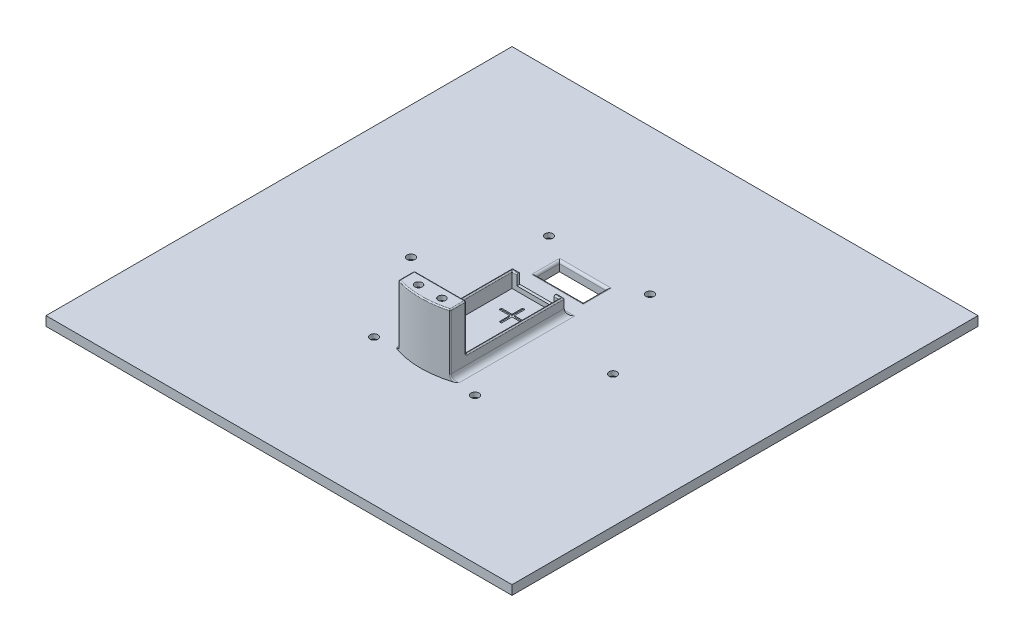
from build123d import *

# Parameters (mm, degrees)
SZKIC1_R                    = 89
DODANIE_WYCI_GNI_CIE2_DEPTH = 4
WYTNIJ_WYCI_GNI_CIE2_DEPTH  = 0.5
SKETCH7_W                   = 20.2
SKETCH7_H                   = 40.9
BOSS_EXTRUDE3_DEPTH         = 6.5
SKETCH8_R                   = 44.4
BOSS_EXTRUDE5_DEPTH         = 1.663834843
SKETCH9_R                   = 39.396065793
CUT_EXTRUDE1_DEPTH          = 9999.5
BOSS_EXTRUDE6_DEPTH         = 20
SKETCH11_R                  = 2.25
CUT_EXTRUDE3_DEPTH          = 5
SKETCH12_R                  = 1.7
CUT_EXTRUDE4_DEPTH          = 10
CUT_EXTRUDE5_DEPTH          = 10
BOSS_EXTRUDE8_DEPTH         = 2
SKETCH21_R                  = 1.6
CUT_EXTRUDE6_DEPTH          = 2
FILLET5_R                   = 2
FILLET6_R                   = 2.5
FILLET7_R                   = 2
SKETCH24_R                  = 1.7
CUT_EXTRUDE7_DEPTH          = 15
CHAMFER1_SIZE               = 2
SKETCH25_W                  = 20.2
SKETCH25_H                  = 10
CUT_EXTRUDE8_DEPTH          = 10
FILLET8_R                   = 1
FILLET10_R                  = 0.5
FILLET16_R                  = 0.5
SKETCH26_W                  = 8
SKETCH26_H                  = 4
SKETCH26_H_2                = 2.729527053
CUT_EXTRUDE9_DEPTH          = 10
BOSS_EXTRUDE9_DEPTH         = 4


with BuildPart() as part:
    # Szkic1 → Dodanie-wyciągnięcie2 (new body)
    with BuildSketch(Plane(origin=(0, 0, 0), x_dir=(1, 0, 0), z_dir=(0, 1, 0))):
        with Locations(Location((0, 0, 0), (0, 0, 270))):
            Circle(SZKIC1_R)
    extrude(amount=DODANIE_WYCI_GNI_CIE2_DEPTH)

    # Szkic4 → Wytnij-wyciągnięcie2 (cut)
    with BuildSketch(Plane(origin=(0, 4, 0), x_dir=(1, 0, 0), z_dir=(0, 1, 0))):
        Polygon((5, 0.5), (5, 0), (5, -0.5), (0.5, -0.5), (0.5, -5), (-0.5, -5), (-0.5, -0.5), (-5, -0.5), (-5, 0.5), (-0.5, 0.5), (-0.5, 5), (0.5, 5), (0.5, 0.5), align=None)
    extrude(amount=-WYTNIJ_WYCI_GNI_CIE2_DEPTH, mode=Mode.SUBTRACT)

    # Sketch7 → Boss-Extrude3 (add)
    with BuildSketch(Plane(origin=(0, 4, 0), x_dir=(1, 0, 0), z_dir=(0, 1, 0))):
        with BuildLine():
            Line((-11.1, 11.319281106), (-11.1, -37.544014806))
            ThreePointArc((-11.1, -37.544014806), (0, -39.150517848), (11.1, -37.544014806))
            Line((11.1, -37.544014806), (11.1, 11.319281106))
            Line((11.1, 11.319281106), (-11.1, 11.319281106))
        make_face()
        with Locations((0, -10.35)):
            Rectangle(SKETCH7_W, SKETCH7_H, mode=Mode.SUBTRACT)
    extrude(amount=BOSS_EXTRUDE3_DEPTH)


with BuildPart() as body_2:
    # Sketch8 → Boss-Extrude5 (new body)
    with BuildSketch(Plane(origin=(0, 4, 0), x_dir=(1, 0, 0), z_dir=(0, 1, 0))):
        with Locations(Location((0, 0, 0), (0, 0, 270))):
            Circle(SKETCH8_R)
    extrude(amount=-BOSS_EXTRUDE5_DEPTH)

    # Sketch9 → Cut-Extrude1 (cut)
    with BuildSketch(Plane(origin=(0, 2.336165157, 0), x_dir=(-1, 0, 0), z_dir=(0, -1, 0))):
        with Locations(Location((0, 0, 0), (0, 0, 90))):
            Circle(SKETCH9_R)
    extrude(amount=-CUT_EXTRUDE1_DEPTH, mode=Mode.SUBTRACT)

    # Combine2: union part
    add(part.part)

    # Sketch10 → Boss-Extrude6 (add)
    with BuildSketch(Plane(origin=(0, 10.5, 0), x_dir=(1, 0, 0), z_dir=(0, 1, 0))):
        with BuildLine():
            Line((10.1, -30.8), (-10.1, -30.8))
            Line((-10.1, -30.8), (-11.1, -30.8))
            Line((-11.1, -30.8), (-11.1, -37.544014806))
            ThreePointArc((-11.1, -37.544014806), (0, -39.150517848), (11.1, -37.544014806))
            Line((11.1, -37.544014806), (11.1, -30.8))
            Line((11.1, -30.8), (10.1, -30.8))
        make_face()
    extrude(amount=BOSS_EXTRUDE6_DEPTH)

    # Sketch11 → Cut-Extrude3 (cut)
    # profile 1 of 8: a face of its own
    with BuildSketch(Plane(origin=(0, 30.5, 0), x_dir=(1, 0, 0), z_dir=(0, 1, 0))):
        with BuildLine():
            Line((-2.855061196, -32.526564386), (-4.921306965, -32.232478095))
            Line((-4.921306965, -32.232478095), (-4.921306965, -32.911704184))
            ThreePointArc((-4.921306965, -32.911704184), (-3.330316708, -33.570713926), (-2.671306965, -35.161704184))
            ThreePointArc((-2.671306965, -35.161704184), (-4.921306965, -37.411704184), (-7.171306965, -35.161704184))
            Line((-7.171306965, -35.161704184), (-8.046848952, -35.161704184))
            Line((-8.046848952, -35.161704184), (-6.987552735, -37.796843981))
            Line((-6.987552735, -37.796843981), (-3.672331843, -38.268695409))
            Line((-3.672331843, -38.268695409), (-1.606086073, -35.633555612))
            Line((-1.606086073, -35.633555612), (-2.855061196, -32.526564386))
        make_face()
    # profile 2 of 8: a face of its own
    with BuildSketch(Plane(origin=(0, 30.5, 0), x_dir=(1, 0, 0), z_dir=(0, 1, 0))):
        with BuildLine():
            Line((-4.921306965, -32.911704184), (-4.921306965, -32.232478095))
            Line((-4.921306965, -32.232478095), (-6.170282088, -32.054712958))
            Line((-6.170282088, -32.054712958), (-8.236527857, -34.689852756))
            Line((-8.236527857, -34.689852756), (-8.046848952, -35.161704184))
            Line((-8.046848952, -35.161704184), (-7.171306965, -35.161704184))
            ThreePointArc((-7.171306965, -35.161704184), (-6.512297223, -33.570713926), (-4.921306965, -32.911704184))
        make_face()
    # profile 3 of 8: a face of its own
    with BuildSketch(Plane(origin=(0, 30.5, 0), x_dir=(1, 0, 0), z_dir=(0, 1, 0))):
        with BuildLine():
            ThreePointArc((-2.671306965, -35.161704184), (-3.330316708, -33.570713926), (-4.921306965, -32.911704184))
            Line((-4.921306965, -32.911704184), (-4.921306965, -35.161704184))
            Line((-4.921306965, -35.161704184), (-7.171306965, -35.161704184))
            ThreePointArc((-7.171306965, -35.161704184), (-4.921306965, -37.411704184), (-2.671306965, -35.161704184))
        make_face()
    # profile 4 of 8: a face of its own
    with BuildSketch(Plane(origin=(0, 30.5, 0), x_dir=(1, 0, 0), z_dir=(0, 1, 0))):
        with BuildLine():
            Line((-4.921306965, -35.161704184), (-4.921306965, -32.911704184))
            ThreePointArc((-4.921306965, -32.911704184), (-6.512297223, -33.570713926), (-7.171306965, -35.161704184))
            Line((-7.171306965, -35.161704184), (-4.921306965, -35.161704184))
        make_face()
    # profile 5 of 8: a face of its own
    with BuildSketch(Plane(origin=(0, 30.5, 0), x_dir=(1, 0, 0), z_dir=(0, 1, 0))):
        with BuildLine():
            ThreePointArc((-2.671306965, -35.161704184), (-3.330316708, -33.570713926), (-4.921306965, -32.911704184))
            Line((-4.921306965, -32.911704184), (-4.921306965, -35.161704184))
            Line((-4.921306965, -35.161704184), (-7.171306965, -35.161704184))
            ThreePointArc((-7.171306965, -35.161704184), (-4.921306965, -37.411704184), (-2.671306965, -35.161704184))
        make_face()
    # profile 6 of 8: a face of its own
    with BuildSketch(Plane(origin=(0, 30.5, 0), x_dir=(1, 0, 0), z_dir=(0, 1, 0))):
        with BuildLine():
            Line((-4.921306965, -35.161704184), (-4.921306965, -32.911704184))
            ThreePointArc((-4.921306965, -32.911704184), (-6.512297223, -33.570713926), (-7.171306965, -35.161704184))
            Line((-7.171306965, -35.161704184), (-4.921306965, -35.161704184))
        make_face()
    # profile 7 of 8: a face of its own
    with BuildSketch(Plane(origin=(0, 30.5, 0), x_dir=(1, 0, 0), z_dir=(0, 1, 0))):
        Polygon((1.606086073, -35.633555612), (2.855061196, -32.526564386), (6.170282088, -32.054712958), (8.236527857, -34.689852756), (6.987552735, -37.796843981), (3.672331843, -38.268695409), align=None)
        with Locations((4.921306965, -35.161704184)):
            Circle(SKETCH11_R, mode=Mode.SUBTRACT)
    # profile 8 of 8: a face of its own
    with BuildSketch(Plane(origin=(0, 30.5, 0), x_dir=(1, 0, 0), z_dir=(0, 1, 0))):
        with Locations((4.921306965, -35.161704184)):
            Circle(SKETCH11_R)
    extrude(amount=-CUT_EXTRUDE3_DEPTH, mode=Mode.SUBTRACT)

    # Sketch12 → Cut-Extrude4 (cut)
    with BuildSketch(Plane(origin=(0, 25.5, 0), x_dir=(1, 0, 0), z_dir=(0, 1, 0))):
        with Locations(Location((-4.921306965, -35.161704184, 0), (0, 0, 270))):
            Circle(SKETCH12_R)
    extrude(amount=-CUT_EXTRUDE4_DEPTH, mode=Mode.SUBTRACT)

    # Sketch13 → Cut-Extrude5 (cut)
    with BuildSketch(Plane(origin=(0, 25.5, 0), x_dir=(1, 0, 0), z_dir=(0, 1, 0))):
        with BuildLine():
            ThreePointArc((6.604345369, -34.922159339), (4.681762121, -33.47866578), (3.238268562, -35.401249028))
            Line((3.238268562, -35.401249028), (6.604345369, -34.922159339))
        make_face()
        with BuildLine():
            Line((6.604345369, -34.922159339), (3.238268562, -35.401249028))
            ThreePointArc((3.238268562, -35.401249028), (5.041379265, -36.857458483), (6.621306965, -35.161704184))
            ThreePointArc((6.621306965, -35.161704184), (6.617061264, -35.041631884), (6.604345369, -34.922159339))
        make_face()
    extrude(amount=-CUT_EXTRUDE5_DEPTH, mode=Mode.SUBTRACT)

    # Sketch20 → Boss-Extrude8 (add)
    with BuildSketch(Plane(origin=(0, 30.5, 0), x_dir=(1, 0, 0), z_dir=(0, 1, 0))):
        with BuildLine():
            Line((-11.1, -30.8), (11.1, -30.8))
            Line((11.1, -30.8), (11.1, -37.544014806))
            ThreePointArc((11.1, -37.544014806), (0, -39.150517848), (-11.1, -37.544014806))
            Line((-11.1, -37.544014806), (-11.1, -30.8))
        make_face()
    extrude(amount=-BOSS_EXTRUDE8_DEPTH)

    # Sketch21 → Cut-Extrude6 (cut)
    with BuildSketch(Plane(origin=(0, 30.5, 0), x_dir=(1, 0, 0), z_dir=(0, 1, 0))):
        with BuildLine():
            ThreePointArc((-5, -33.5), (-6.13137085, -33.96862915), (-6.6, -35.1))
            Line((-6.6, -35.1), (-5, -35.1))
            Line((-5, -35.1), (-5, -33.5))
        make_face()
        with BuildLine():
            Line((-5, -35.1), (-6.6, -35.1))
            ThreePointArc((-6.6, -35.1), (-5, -36.7), (-3.4, -35.1))
            ThreePointArc((-3.4, -35.1), (-3.86862915, -33.96862915), (-5, -33.5))
            Line((-5, -33.5), (-5, -35.1))
        make_face()
        with Locations(Location((5, -35.1, 0), (0, 0, 270))):
            Circle(SKETCH21_R)
    extrude(amount=-CUT_EXTRUDE6_DEPTH, mode=Mode.SUBTRACT)

    # Fillet5
    fillet5_edges = [body_2.edges().sort_by_distance(p)[0] for p in [
        (0, 4, -11.319281106),
    ]]
    fillet(fillet5_edges, radius=FILLET5_R)

    # Fillet6
    fillet6_edges = [body_2.edges().sort_by_distance(p)[0] for p in [
        (11.1, 4, 12.11236685),
    ]]
    fillet(fillet6_edges, radius=FILLET6_R)

    # Fillet7
    fillet7_edges = [body_2.edges().sort_by_distance(p)[0] for p in [
        (-11.1, 4, 12.11236685),
    ]]
    fillet(fillet7_edges, radius=FILLET7_R)

    # Sketch24 → Cut-Extrude7 (cut)
    with BuildSketch(Plane.XZ):
        with BuildLine():
            ThreePointArc((-19.98, 37.550861508), (-22.53, 39.023104695), (-22.53, 36.078618322))
            Line((-22.53, 36.078618322), (-21.68, 37.550861508))
            Line((-21.68, 37.550861508), (-19.98, 37.550861508))
        make_face()
        with BuildLine():
            Line((-21.68, 37.550861508), (-22.53, 36.078618322))
            ThreePointArc((-22.53, 36.078618322), (-20.83, 36.078618322), (-19.98, 37.550861508))
            Line((-19.98, 37.550861508), (-21.68, 37.550861508))
        make_face()
        with BuildLine():
            ThreePointArc((23.38, 37.550861508), (21.68, 39.250861508), (19.98, 37.550861508))
            Line((19.98, 37.550861508), (21.68, 37.550861508))
            Line((21.68, 37.550861508), (22.53, 36.078618322))
            ThreePointArc((22.53, 36.078618322), (23.152243186, 36.700861508), (23.38, 37.550861508))
        make_face()
        with BuildLine():
            Line((21.68, 37.550861508), (19.98, 37.550861508))
            ThreePointArc((19.98, 37.550861508), (20.83, 36.078618322), (22.53, 36.078618322))
            Line((22.53, 36.078618322), (21.68, 37.550861508))
        make_face()
        with BuildLine():
            ThreePointArc((42.51, 1.472243186), (41.66, 0), (42.51, -1.472243186))
            Line((42.51, -1.472243186), (43.36, 0))
            Line((43.36, 0), (42.51, 1.472243186))
        make_face()
        with BuildLine():
            Line((43.36, 0), (42.51, -1.472243186))
            ThreePointArc((42.51, -1.472243186), (44.21, -1.472243186), (45.06, 0))
            ThreePointArc((45.06, 0), (44.21, 1.472243186), (42.51, 1.472243186))
            Line((42.51, 1.472243186), (43.36, 0))
        make_face()
        with BuildLine():
            ThreePointArc((22.53, -36.078618322), (20.83, -36.078618322), (19.98, -37.550861508))
            Line((19.98, -37.550861508), (21.68, -37.550861508))
            Line((21.68, -37.550861508), (22.53, -36.078618322))
        make_face()
        with BuildLine():
            Line((21.68, -37.550861508), (19.98, -37.550861508))
            ThreePointArc((19.98, -37.550861508), (21.68, -39.250861508), (23.38, -37.550861508))
            ThreePointArc((23.38, -37.550861508), (23.152243186, -36.700861508), (22.53, -36.078618322))
            Line((22.53, -36.078618322), (21.68, -37.550861508))
        make_face()
        with BuildLine():
            ThreePointArc((-19.98, -37.550861508), (-20.83, -36.078618322), (-22.53, -36.078618322))
            Line((-22.53, -36.078618322), (-21.68, -37.550861508))
            Line((-21.68, -37.550861508), (-19.98, -37.550861508))
        make_face()
        with BuildLine():
            Line((-21.68, -37.550861508), (-22.53, -36.078618322))
            ThreePointArc((-22.53, -36.078618322), (-22.53, -39.023104695), (-19.98, -37.550861508))
            Line((-19.98, -37.550861508), (-21.68, -37.550861508))
        make_face()
        with Locations(Location((-43.36, 0, 0), (0, 0, 270))):
            Circle(SKETCH24_R)
    extrude(amount=-CUT_EXTRUDE7_DEPTH, mode=Mode.SUBTRACT)

    # Chamfer1
    chamfer1_edges = [body_2.edges().sort_by_distance(p)[0] for p in [
        (-43.36, 0, 1.7),
        (23.38, 0, 37.550861508),
        (44.21, 0, -1.472243186),
        (20.83, 0, -39.023104695),
        (-23.38, 0, -37.550861508),
        (-20.83, 0, 39.023104695),
    ]]
    chamfer(chamfer1_edges, length=CHAMFER1_SIZE)

    # Sketch25 → Cut-Extrude8 (cut)
    with BuildSketch(Plane(origin=(0, 4, 0), x_dir=(1, 0, 0), z_dir=(0, 1, 0))):
        with Locations((0, 25.5)):
            Rectangle(SKETCH25_W, SKETCH25_H)
    extrude(amount=-CUT_EXTRUDE8_DEPTH, mode=Mode.SUBTRACT)

    # Fillet8
    fillet8_edges = [body_2.edges().sort_by_distance(p)[0] for p in [
        (0, 4, -30.5),
        (-10.1, 4, -25.5),
        (0, 4, -20.5),
        (10.1, 4, -25.5),
    ]]
    fillet(fillet8_edges, radius=FILLET8_R)

    # Fillet10
    fillet10_edges = [body_2.edges().sort_by_distance(p)[0] for p in [
        (11.1, 10.5, 9.740359447),
        (10.1, 7.25, 30.8),
        (-10.1, 10.5, 10.35),
        (-10.1, 7.25, 30.8),
        (0, 10.5, -10.1),
        (10.1, 10.5, 10.35),
        (-11.1, 10.5, 9.740359447),
        (0, 10.5, -11.319281106),
        (10.6, 10.5, 30.8),
        (11.1, 20.5, 30.8),
        (-11.1, 20.5, 30.8),
        (-10.6, 10.5, 30.8),
    ]]
    fillet(fillet10_edges, radius=FILLET10_R - 0.0001)  # a hair under: the kernel refuses the full size

    # Fillet16
    fillet16_edges = [body_2.edges().sort_by_distance(p)[0] for p in [
        (-11.1, 18.25, 37.544014806),
        (11.1, 18.5, 37.544014806),
        (11.739475322, 4.830135347, 37.348999544),
        (-11.614781233, 4.6605504, 37.387964705),
        (0, 30.5, 30.8),
        (-11.1, 30.5, 34.421957403),
        (-10.95358268, 30.5, 30.94641732),
        (10.95358268, 30.5, 30.94641732),
        (0, 30.5, 39.150517848),
        (11.1, 30.5, 34.421957403),
    ]]
    fillet(fillet16_edges, radius=FILLET16_R - 0.0001)  # a hair under: the kernel refuses the full size

    # Sketch26 → Cut-Extrude9 (cut)
    with BuildSketch(Plane(origin=(0, 0, -11.319281106), x_dir=(-1, 0, 0), z_dir=(0, 0, -1))):
        with Locations((-4, 8)):
            Rectangle(SKETCH26_W, SKETCH26_H)
        with Locations((-4, 11.364763526)):
            Rectangle(SKETCH26_W, SKETCH26_H_2)
        with Locations((4, 11.364763526)):
            Rectangle(SKETCH26_W, SKETCH26_H_2)
        with Locations((4, 8)):
            Rectangle(SKETCH26_W, SKETCH26_H)
    extrude(amount=-CUT_EXTRUDE9_DEPTH, mode=Mode.SUBTRACT)

    # Sketch27 → Boss-Extrude9 (add)
    with BuildSketch(Plane.XZ):
        Polygon((100, 100), (0, 100), (-100, 100), (-100, -100), (100, -100), align=None)
        Polygon((-61.247733993, 57.934625575), (0, 57.934625575), (0, 65.098103235), (54.263343275, 65.098103235), (54.263343275, -49.517539325), (-61.247733993, -49.517539325), align=None, mode=Mode.SUBTRACT)
    extrude(amount=-BOSS_EXTRUDE9_DEPTH)


solid = body_2.part
